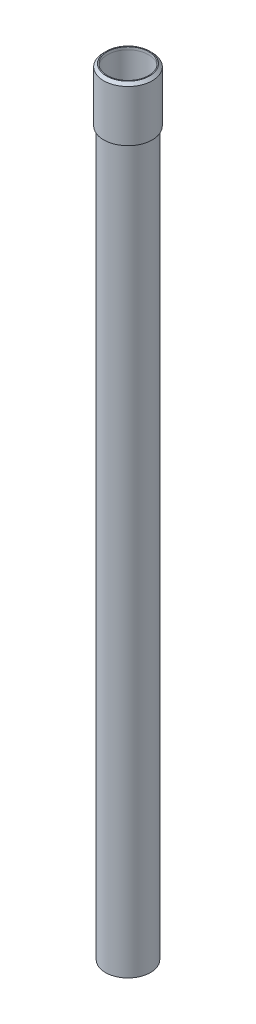
from build123d import *

# Parameters (mm, degrees)
SKETCH1_R      = 12.5
SKETCH1_R_2    = 11.5
EXTRUDE1_DEPTH = 215
CHAMFER1_SIZE  = 1.5


with BuildPart() as part:
    # Sketch1 → Extrude1 (new, symmetric)
    with BuildSketch(Plane(origin=(0, 0, 0), x_dir=(1, 0, 0), z_dir=(0, 1, 0))):
        Circle(SKETCH1_R)
        Circle(SKETCH1_R_2, mode=Mode.SUBTRACT)
    extrude(amount=EXTRUDE1_DEPTH, both=True)


with BuildPart() as body_2:
    # Sketch2 → Revolve1 (revolve)
    with BuildSketch(Plane.XY):
        Polygon((13.5, 216.5), (13.5, 186.5), (12.5, 186.5), (12.5, 215), (11.5, 215), (11.5, 216.5), align=None)
    revolve(axis=Axis((0, 224.324804611, 0), (0, -1, 0)))

    # Chamfer1
    chamfer1_edges = [body_2.edges().sort_by_distance(p)[0] for p in [
        (-13.5, 216.5, 0),
    ]]
    chamfer(chamfer1_edges, length=CHAMFER1_SIZE)


solid = Compound([part.part, body_2.part])
